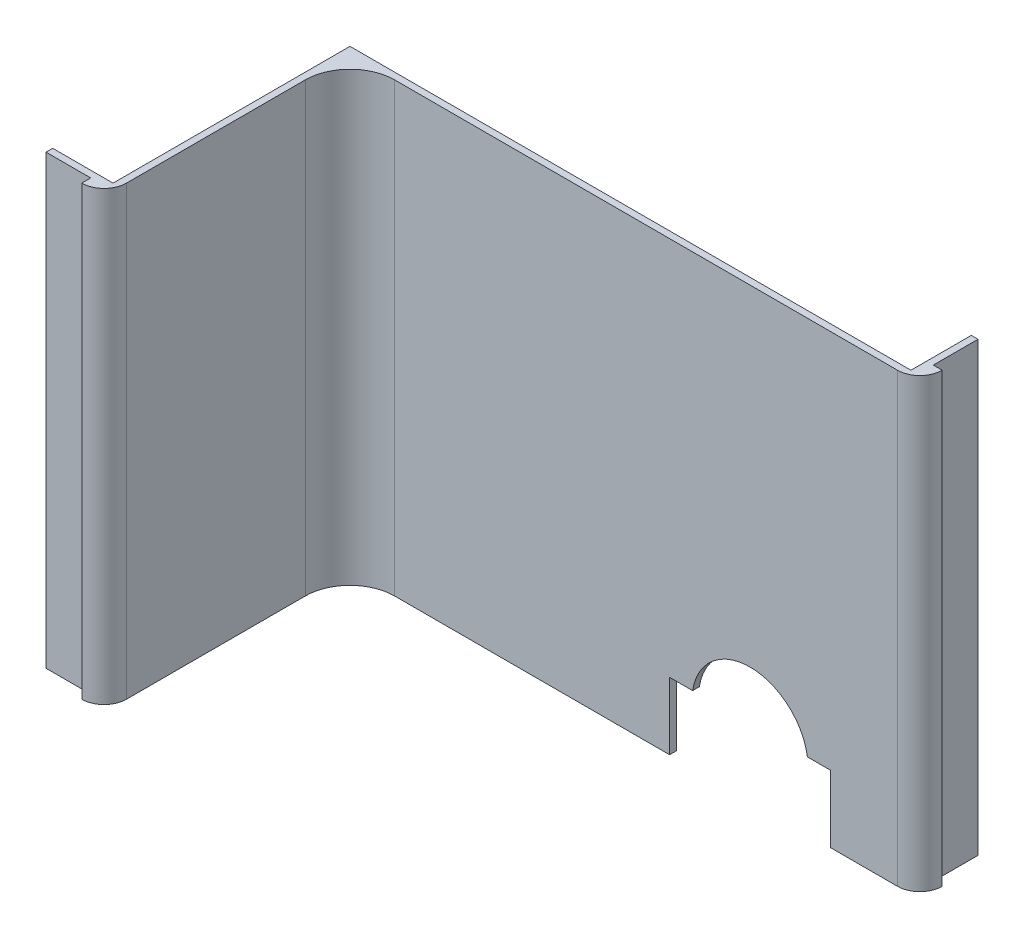
from build123d import *

# Parameters (mm, degrees)
EXTRUDE_1_DEPTH     = 100
CUT_EXTRUDE_1_DEPTH = 179.693172785


with BuildPart() as part:
    # Эскиз1 → Бобышка-Вытянуть1 (new body)
    with BuildSketch(Plane(origin=(0, 0, 0), x_dir=(1, 0, 0), z_dir=(0, 1, 0))):
        with BuildLine():
            Line((0, 0), (-112.5, 0))
            ThreePointArc((-112.5, 0), (-119.571067812, -2.928932188), (-122.5, -10))
            Line((-122.5, -10), (-122.5, -50))
            ThreePointArc((-122.5, -50), (-123.964466094, -53.535533906), (-127.5, -55))
            Line((-127.5, -55), (-127.5, -53))
            Line((-127.5, -53), (-137.5, -53))
            Line((-137.5, -53), (-137.5, -51.5))
            Line((-137.5, -51.5), (-124, -51.5))
            Line((-124, -51.5), (-124, 1.5))
            Line((-124, 1.5), (1.5, 1.5))
            Line((1.5, 1.5), (1.5, 15))
            Line((1.5, 15), (3, 15))
            Line((3, 15), (3, 5))
            Line((3, 5), (5, 5))
            ThreePointArc((5, 5), (3.535533906, 1.464466094), (0, 0))
        make_face()
    extrude(amount=EXTRUDE_1_DEPTH)

    # Эскиз4 → Вырез-Вытянуть1 (cut, through all)
    with BuildSketch(Plane.XY):
        with BuildLine():
            Line((-15, 0), (-51, 0))
            Line((-51, 0), (-51, 15))
            Line((-51, 15), (-45.845232579, 15))
            ThreePointArc((-45.845232579, 15), (-32.998579553, 25.999999922), (-20.154330668, 14.997192881))
            Line((-20.154330668, 14.997192881), (-15, 14.997192881))
            Line((-15, 14.997192881), (-15, 0))
        make_face()
    extrude(amount=-CUT_EXTRUDE_1_DEPTH, mode=Mode.SUBTRACT)


solid = part.part
